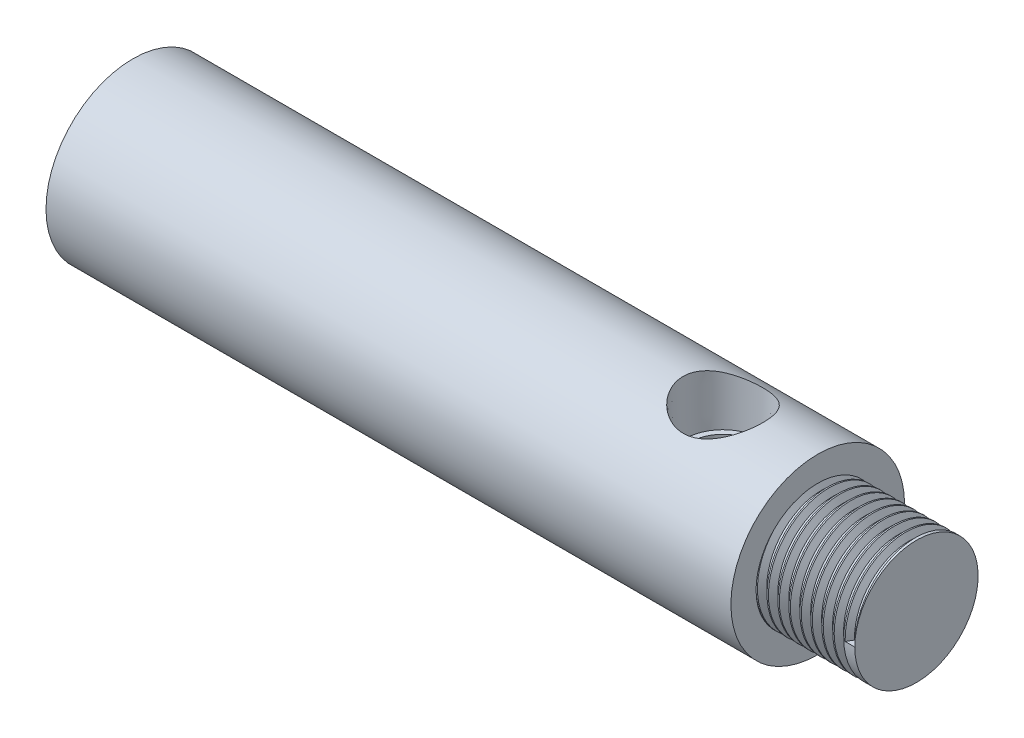
from build123d import *

# Parameters (mm, degrees)
SKETCH1_R           = 11.176
BOSS_EXTRUDE1_DEPTH = 88.138
SKETCH2_R           = 7.9375
BOSS_EXTRUDE2_DEPTH = 12.7
THREAD1_PITCH       = 1.411111111


with BuildPart() as part:
    # Sketch1 → Boss-Extrude1 (new body)
    with BuildSketch(Plane(origin=(0, 0, 0), x_dir=(0, 0, -1), z_dir=(1, 0, 0))):
        Circle(SKETCH1_R)
    extrude(amount=BOSS_EXTRUDE1_DEPTH)

    # Sketch2 → Boss-Extrude2 (add)
    with BuildSketch(Plane(origin=(88.138, 0, 0), x_dir=(0, 0, -1), z_dir=(1, 0, 0))):
        Circle(SKETCH2_R)
    extrude(amount=BOSS_EXTRUDE2_DEPTH)

    # Thread1: the profile of Thread Profile1 profile screwed along a right-hand helix of 9 turns, 8 arcs to a turn; built about Z, then put on its axis
    thread1_z = Axis((0, 0, 0), (0, 0, 1))
    thread1_corners = [(7.9378, 0, -0.000173205), (7.9378, 0, 1.234895423), (7.17371371, 0, 0.793749998), (7.17371371, 0, 0.44097222)]
    with BuildLine(mode=Mode.PRIVATE) as thread1_profile:
        Line(thread1_corners[0], thread1_corners[1])
        Line(thread1_corners[1], thread1_corners[2])
        Line(thread1_corners[2], thread1_corners[3])
        Line(thread1_corners[3], thread1_corners[0])
    thread1_cap = Face(thread1_profile.wire())
    thread1_turn_angles = [0, 22.5, 45, 67.5, 90, 112.5, 135, 157.5, 180, 202.5, 225, 247.5, 270, 292.5, 315, 337.5, 360]
    thread1_turn_weights = [1, 0.9238795325112867, 1, 0.9238795325112867, 1, 0.9238795325112867, 1, 0.9238795325112867, 1, 0.9238795325112867, 1, 0.9238795325112867, 1, 0.9238795325112867, 1, 0.9238795325112867, 1]
    thread1_turn_rails = [Edge.make_bspline([Vector(p[0], p[1], 0).rotate(thread1_z, thread1_turn_angles[k]) / thread1_turn_weights[k] + Vector(0, 0, p[2] + THREAD1_PITCH * thread1_turn_angles[k] / 360) for k in range(17)], [0, 0, 0, 1, 1, 2, 2, 3, 3, 4, 4, 5, 5, 6, 6, 7, 7, 8, 8, 8], 2, thread1_turn_weights) for p in thread1_corners]
    thread1_turn_sides = [Face.make_surface_from_curves(thread1_turn_rails[p[0]], thread1_turn_rails[p[1]]) for p in [(0, 1), (1, 2), (2, 3), (3, 0)]]
    thread1 = Plane(origin=(100.838, 0, 0), x_dir=(0, 0, 1), z_dir=(-1, 0, 0)) * Solid(Shell([*[p.moved(Location((0, 0, THREAD1_PITCH * i))) for i in range(9) for p in thread1_turn_sides], thread1_cap, thread1_cap.rotate(thread1_z, 3240).moved(Location((0, 0, THREAD1_PITCH * 3240 / 360)))]))
    add(thread1, mode=Mode.SUBTRACT)

    # Sketch7 → 1/8 NPT Tapped Hole1 (revolve, cut)
    with BuildSketch(Plane(origin=(75.946, 11.176, 0), x_dir=(0, 0, 1), z_dir=(1, 0, 0))):
        Polygon((0, 0), (0, 14.217468714), (4.2164, 11.684), (4.2164, 6.858), (4.936181096, 6.858), (5.1415188, 0), align=None)
    revolve(axis=Axis((75.946, 17.526, 0), (0, -1, 0)), mode=Mode.SUBTRACT)

    # Sketch9 → 1/8 NPT Tapped Hole2 (revolve, cut)
    with BuildSketch(Plane.ZX):
        Polygon((0, 0), (0, 14.217468714), (4.2164, 11.684), (4.2164, 6.858), (4.936181096, 6.858), (5.1415188, 0), align=None)
    revolve(axis=Axis((-6.35, 0, 0), (1, 0, 0)), mode=Mode.SUBTRACT)


solid = part.part
